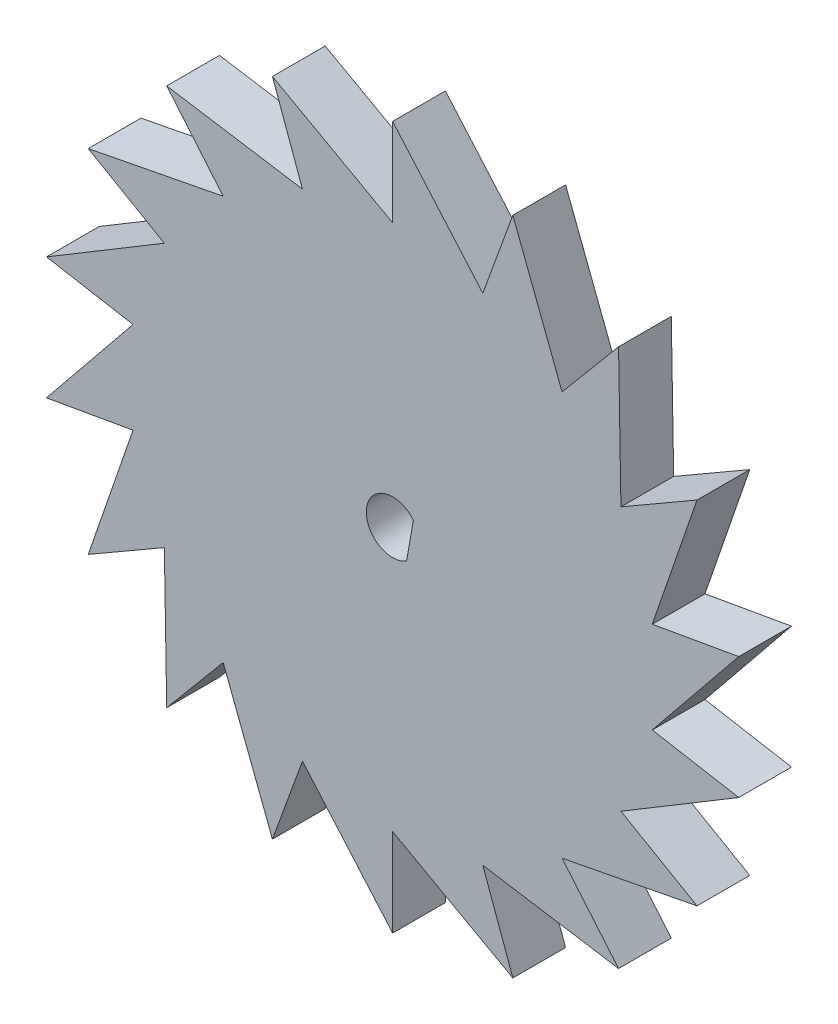
from build123d import *

# Parameters (mm, degrees)
BOSS_EXTRUDE1_DEPTH = 3
CIRPATTERN1_COUNT   = 18
CUT_EXTRUDE1_DEPTH  = 3


with BuildPart() as part:
    # Sketch1 → Boss-Extrude1 (new body)
    with BuildSketch(Plane.XY):
        Polygon((0, 0), (0, 20), (5.13030215, 14.095389312), align=None)
    boss_extrude1 = extrude(amount=BOSS_EXTRUDE1_DEPTH)

    # CirPattern1: Boss-Extrude1 ×18 about axis
    cirpattern1_axis = Axis((0, 0, 3), (0, 0, -1))
    for i in range(1, CIRPATTERN1_COUNT):
        add(boss_extrude1.rotate(cirpattern1_axis, i * 360 / CIRPATTERN1_COUNT))

    # Sketch5 → Cut-Extrude1 (cut)
    with BuildSketch(Plane.XY.offset(3)):
        with BuildLine():
            Line((1.17901122, 0.927325479), (0.790582224, -1.274746935))
            ThreePointArc((0.790582224, -1.274746935), (-1.477195083, 0.260566092), (1.17901122, 0.927325479))
        make_face()
    extrude(amount=-CUT_EXTRUDE1_DEPTH, mode=Mode.SUBTRACT)


solid = part.part
